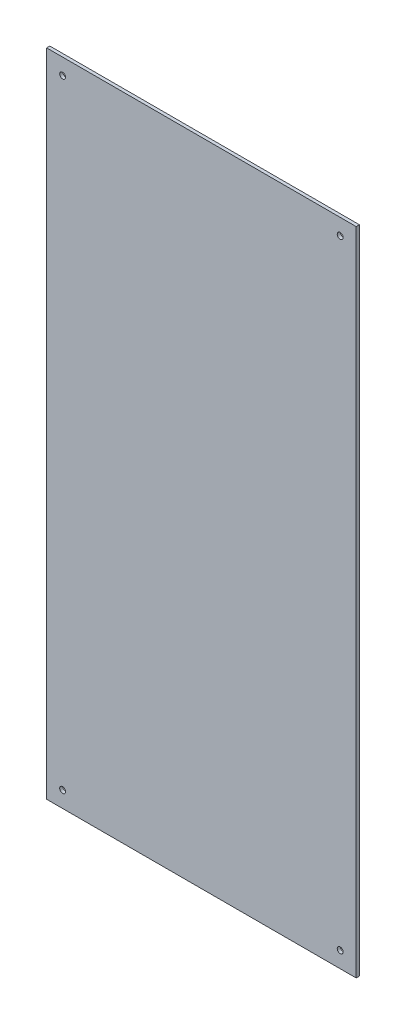
from build123d import *

# Parameters (mm, degrees)
SKETCH1_W            = 290
SKETCH1_H            = 609.6
BOSS_EXTRUDE1_DEPTH  = 3
M5_CLEARANCE_HOLE1_D = 5.5


with BuildPart() as part:
    # Sketch1 → Boss-Extrude1 (new body)
    with BuildSketch(Plane.XY):
        Rectangle(SKETCH1_W, SKETCH1_H)
    extrude(amount=BOSS_EXTRUDE1_DEPTH)

    # M5 Clearance Hole1 (through all)
    with Locations(Plane.XY.offset(3)):
        with Locations((129.995, 289.795), (-129.995, 289.795), (-129.995, -289.795), (129.995, -289.795)):
            Hole(M5_CLEARANCE_HOLE1_D / 2)


solid = part.part
